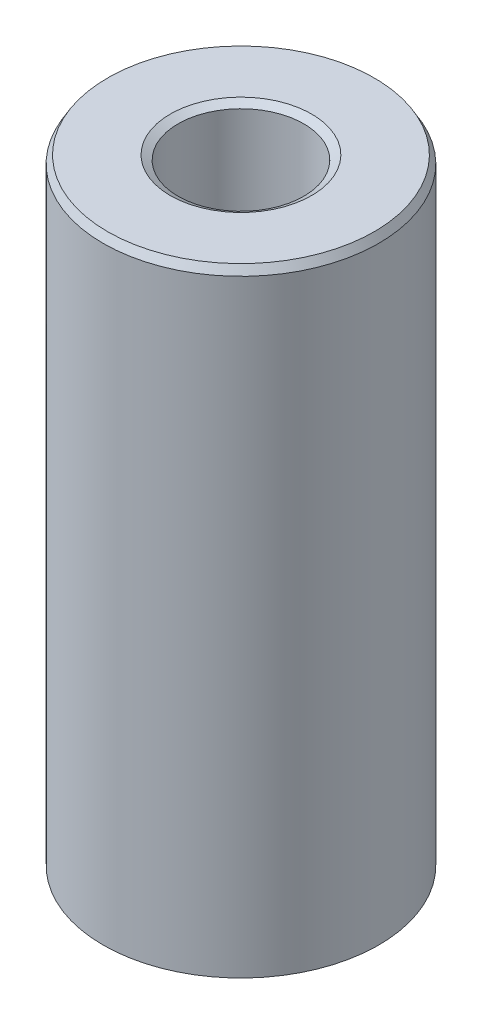
from build123d import *
from OCP.BRepFilletAPI import BRepFilletAPI_MakeChamfer

# Parameters (mm, degrees)
SKETCH1_R           = 60
BOSS_EXTRUDE1_DEPTH = 270.008830242
SKETCH2_R           = 27.363281047
CUT_EXTRUDE1_DEPTH  = 284.027858008
CHAMFER1_SIZE       = 3.41115049
CHAMFER1_SIZE2      = 1.969428654


with BuildPart() as part:
    # Sketch1 → Boss-Extrude1 (new body)
    with BuildSketch(Plane(origin=(0, 0, 0), x_dir=(1, 0, 0), z_dir=(0, 1, 0))):
        Circle(SKETCH1_R)
    extrude(amount=BOSS_EXTRUDE1_DEPTH)

    # Sketch2 → Cut-Extrude1 (cut, through all)
    with BuildSketch(Plane(origin=(0, 0, 0), x_dir=(1, 0, 0), z_dir=(0, 1, 0))):
        Circle(SKETCH2_R)
    extrude(amount=CUT_EXTRUDE1_DEPTH, mode=Mode.SUBTRACT)

    # Chamfer1: one chamfer whose edges measure the first distance from different faces: ONE call of the kernel's chamfer builder (chamfer() names one face for all edges)
    chamfer1_edges_1 = [part.edges().sort_by_distance(p)[0] for p in [
        (-27.363281047, 270.008830242, 0),
    ]]
    chamfer1_side_1 = [part.faces().sort_by_distance(p)[0] for p in [
        (-58.302943725, 270.008830242, 0),
    ]]
    chamfer1_edges_2 = [part.edges().sort_by_distance(p)[0] for p in [
        (-27.363281047, 0, 0),
    ]]
    chamfer1_side_2 = [part.faces().sort_by_distance(p)[0] for p in [
        (-27.363281047, 135.004415121, 0),
    ]]
    chamfer1_edges_3 = [part.edges().sort_by_distance(p)[0] for p in [
        (-60, 0, 0),
    ]]
    chamfer1_side_3 = [part.faces().sort_by_distance(p)[0] for p in [
        (-58.302943725, 0, 0),
    ]]
    chamfer1_edges_4 = [part.edges().sort_by_distance(p)[0] for p in [
        (-60, 270.008830242, 0),
    ]]
    chamfer1_side_4 = [part.faces().sort_by_distance(p)[0] for p in [
        (-60, 135.004415121, 0),
    ]]
    chamfer1 = BRepFilletAPI_MakeChamfer(part.part.solid().wrapped)
    for e in chamfer1_edges_1:
        chamfer1.Add(CHAMFER1_SIZE, CHAMFER1_SIZE2, e.wrapped, chamfer1_side_1[0].wrapped)  # the first distance lies on this face
    for e in chamfer1_edges_2:
        chamfer1.Add(CHAMFER1_SIZE, CHAMFER1_SIZE2, e.wrapped, chamfer1_side_2[0].wrapped)  # the first distance lies on this face
    for e in chamfer1_edges_3:
        chamfer1.Add(CHAMFER1_SIZE, CHAMFER1_SIZE2, e.wrapped, chamfer1_side_3[0].wrapped)  # the first distance lies on this face
    for e in chamfer1_edges_4:
        chamfer1.Add(CHAMFER1_SIZE, CHAMFER1_SIZE2, e.wrapped, chamfer1_side_4[0].wrapped)  # the first distance lies on this face
    add(Compound.cast(chamfer1.Shape()), mode=Mode.REPLACE)


solid = part.part
